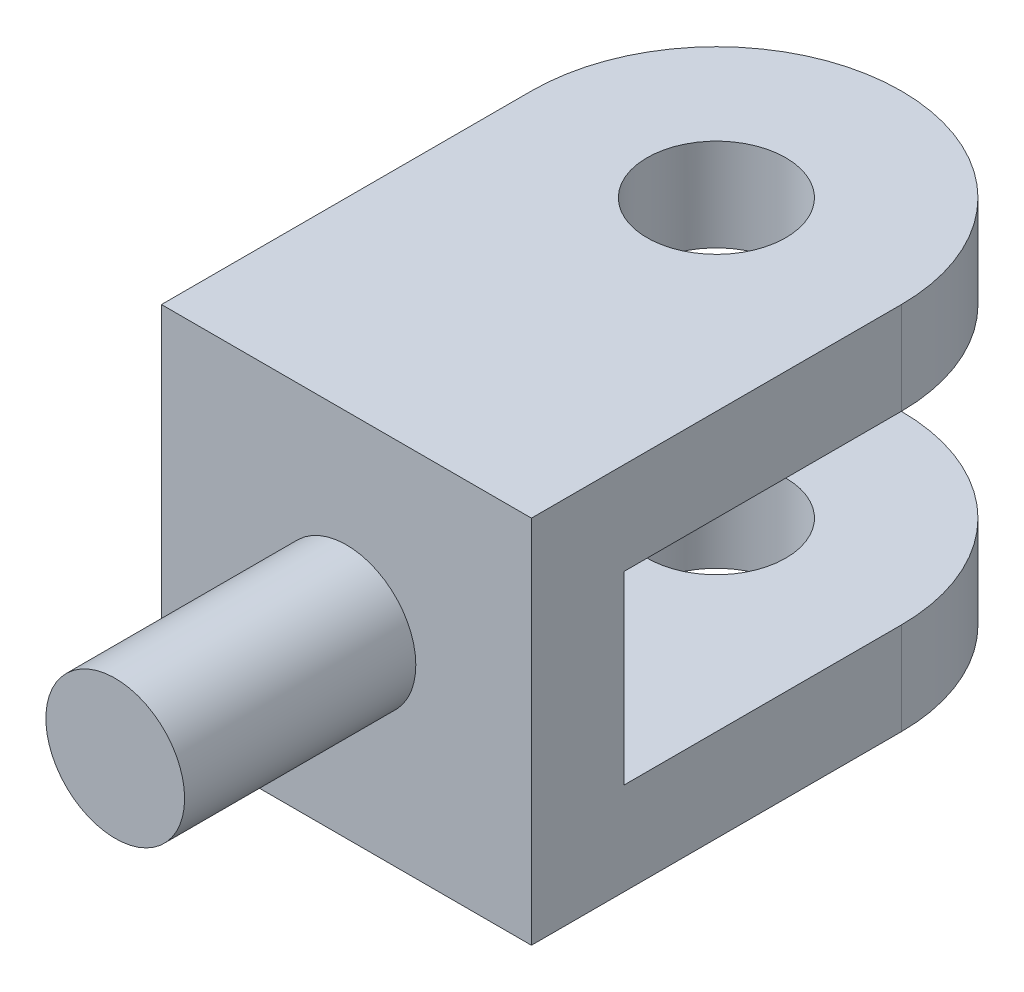
from build123d import *

# Parameters (mm, degrees)
SKETCH1_W           = 16
SKETCH1_H           = 16
BOSS_EXTRUDE1_DEPTH = 24
SKETCH3_R           = 3
BOSS_EXTRUDE2_DEPTH = 10
SKETCH4_W           = 20
SKETCH4_H           = 8
CUT_EXTRUDE1_DEPTH  = 39.418745425
SKETCH5_R           = 3
CUT_EXTRUDE2_DEPTH  = 39.418745425
FILLET1_R           = 8


with BuildPart() as part:
    # Sketch1 → Boss-Extrude1 (new body)
    with BuildSketch(Plane.XY):
        Rectangle(SKETCH1_W, SKETCH1_H)
    extrude(amount=BOSS_EXTRUDE1_DEPTH)

    # Sketch3 → Boss-Extrude2 (add)
    with BuildSketch(Plane.XY.offset(24)):
        Circle(SKETCH3_R)
    extrude(amount=BOSS_EXTRUDE2_DEPTH)

    # Sketch4 → Cut-Extrude1 (cut, through all)
    with BuildSketch(Plane.ZY.offset(8)):
        with Locations((10, 0)):
            Rectangle(SKETCH4_W, SKETCH4_H)
    extrude(amount=-CUT_EXTRUDE1_DEPTH, mode=Mode.SUBTRACT)

    # Sketch5 → Cut-Extrude2 (cut, through all)
    with BuildSketch(Plane.XZ.offset(8)):
        with Locations(Location((0, 8, 0), (0, 0, 270))):
            Circle(SKETCH5_R)
    extrude(amount=-CUT_EXTRUDE2_DEPTH, mode=Mode.SUBTRACT)

    # Fillet1
    fillet1_edges = [part.edges().sort_by_distance(p)[0] for p in [
        (-8, 6, 0),
        (8, 6, 0),
        (8, -6, 0),
        (-8, -6, 0),
    ]]
    fillet(fillet1_edges, radius=FILLET1_R - 0.0001)  # a hair under: the kernel refuses the full size


solid = part.part
